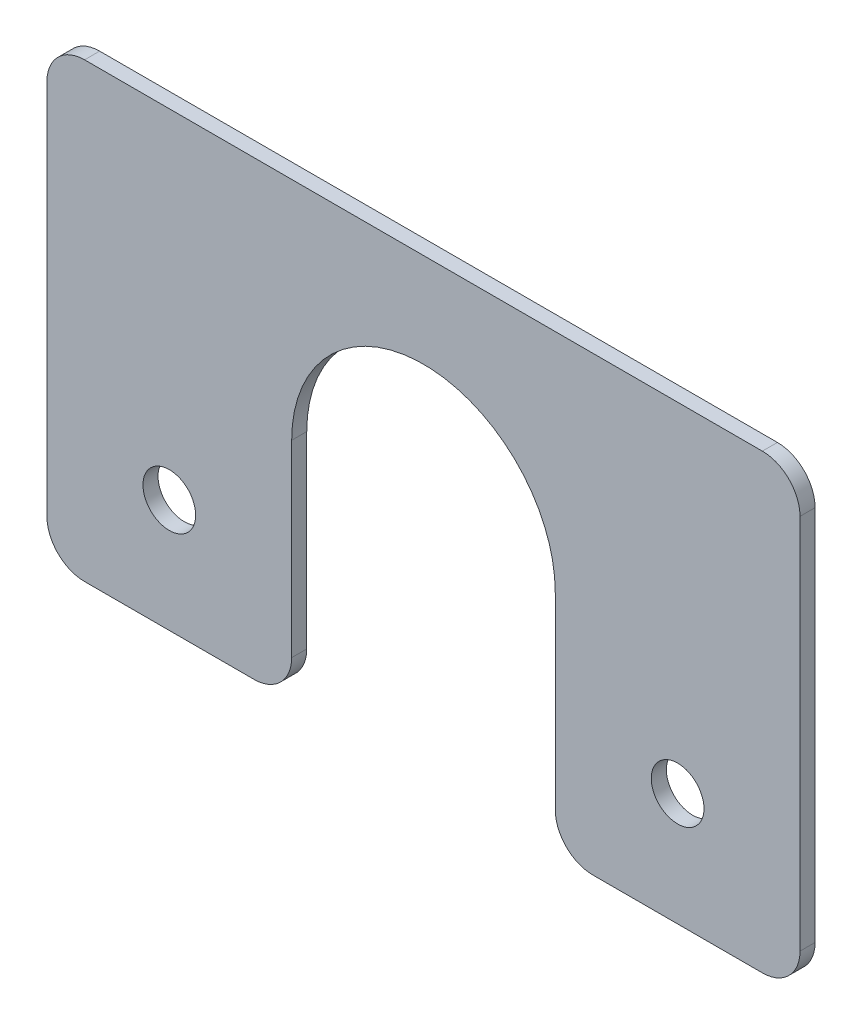
from build123d import *

# Parameters (mm, degrees)
SKETCH1_W          = 100
SKETCH1_H          = 60
BASE_FLANGE1_DEPTH = 2
CUT_EXTRUDE1_DEPTH = 10
FILLET1_R          = 5
SKETCH7_R          = 3.5
CUT_EXTRUDE2_DEPTH = 10
FILLET2_R          = 5


# Sheet-metal steps are written as plain solids
with BuildPart() as part:
    # Sketch1 → Base-Flange1 (new body)
    with BuildSketch(Plane.XY):
        Rectangle(SKETCH1_W, SKETCH1_H)
    extrude(amount=-BASE_FLANGE1_DEPTH)

    # Sketch6 → Cut-Extrude1 (cut)
    with BuildSketch(Plane.XY):
        with BuildLine():
            Line((-17.5, 0), (-17.5, -30))
            Line((-17.5, -30), (17.5, -30))
            Line((17.5, -30), (17.5, 0))
            ThreePointArc((17.5, 0), (0, 17.5), (-17.5, 0))
        make_face()
    extrude(amount=-CUT_EXTRUDE1_DEPTH, mode=Mode.SUBTRACT)

    # Fillet1
    fillet1_edges = [part.edges().sort_by_distance(p)[0] for p in [
        (17.5, -30, -1),
        (50, -30, -1),
        (-50, -30, -1),
        (-50, 30, -1),
        (50, 30, -1),
    ]]
    fillet(fillet1_edges, radius=FILLET1_R)

    # Sketch7 → Cut-Extrude2 (cut)
    with BuildSketch(Plane.XY):
        with Locations((-33.75, -15)):
            Circle(SKETCH7_R)
        with Locations((33.75, -15)):
            Circle(SKETCH7_R)
    extrude(amount=-CUT_EXTRUDE2_DEPTH, mode=Mode.SUBTRACT)

    # Fillet2
    fillet2_edges = [part.edges().sort_by_distance(p)[0] for p in [
        (-17.5, -30, -1),
    ]]
    fillet(fillet2_edges, radius=FILLET2_R)


solid = part.part
